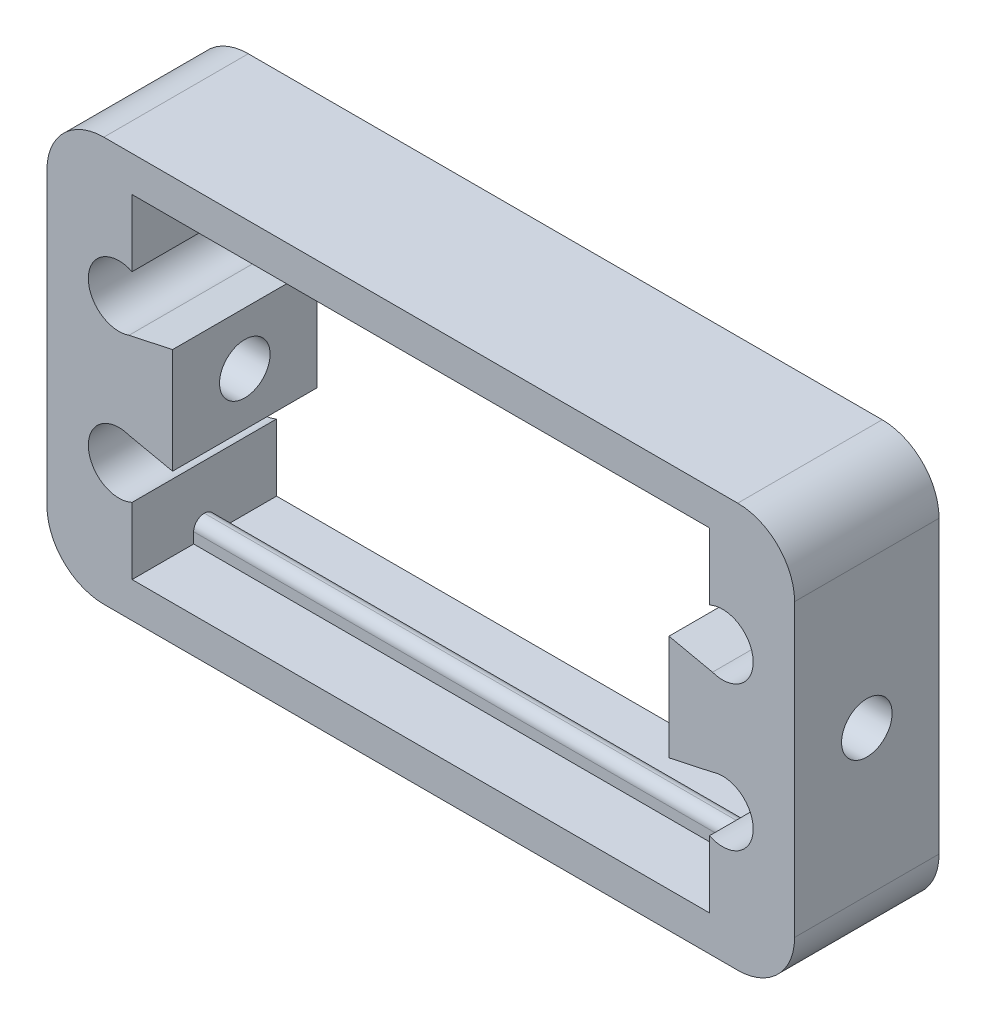
from build123d import *

# Parameters (mm, degrees)
SKETCH1_W                = 26.289
SKETCH1_H                = 14.224
BOSS_EXTRUDE1_DEPTH      = 5.08
BOSS_EXTRUDE2_DEPTH      = 0.375
BOSS_EXTRUDE2_DEPTH_BACK = 0.375
SKETCH2_W                = 20.300617312
SKETCH2_H                = 0.75
FILLET1_R                = 0.375
FILLET2_R                = 2
SKETCH3_R                = 0.889
CUT_EXTRUDE1_DEPTH       = 24.13


with BuildPart() as part:
    # Sketch1 → Boss-Extrude1 (new body)
    with BuildSketch(Plane.XY):
        with Locations((13.1445, 7.112)):
            Rectangle(SKETCH1_W, SKETCH1_H)
        with BuildLine():
            ThreePointArc((2.994191344, 10.624), (1.457238853, 9.709108648), (2.886694423, 8.633977996))
            Line((2.886694423, 8.633977996), (4.417480803, 8.964165012))
            Line((4.417480803, 8.964165012), (4.417480803, 5.259834988))
            Line((4.417480803, 5.259834988), (2.886694423, 5.590022004))
            ThreePointArc((2.886694423, 5.590022004), (1.457238853, 4.514891352), (2.994191344, 3.6))
            Line((2.994191344, 3.6), (2.994191344, 1.25))
            Line((2.994191344, 1.25), (23.294808656, 1.25))
            Line((23.294808656, 1.25), (23.294808656, 3.6))
            ThreePointArc((23.294808656, 3.6), (24.831761147, 4.514891352), (23.402305577, 5.590022004))
            Line((23.402305577, 5.590022004), (21.871519197, 5.259834988))
            Line((21.871519197, 5.259834988), (21.871519197, 8.964165012))
            Line((21.871519197, 8.964165012), (23.402305577, 8.633977996))
            ThreePointArc((23.402305577, 8.633977996), (24.831761147, 9.709108648), (23.294808656, 10.624))
            Line((23.294808656, 10.624), (23.294808656, 12.974))
            Line((23.294808656, 12.974), (2.994191344, 12.974))
            Line((2.994191344, 12.974), (2.994191344, 10.624))
        make_face(mode=Mode.SUBTRACT)
    extrude(amount=BOSS_EXTRUDE1_DEPTH)

    # Sketch2 → Boss-Extrude2 (add, two sides: drawn at the far end of the back side and taken through both)
    with BuildSketch(Plane.XY.offset(2.54).offset(-BOSS_EXTRUDE2_DEPTH_BACK)):
        with Locations((13.1445, 1.625)):
            Rectangle(SKETCH2_W, SKETCH2_H)
        with Locations((13.1445, 12.599)):
            Rectangle(SKETCH2_W, SKETCH2_H)
    extrude(amount=BOSS_EXTRUDE2_DEPTH + BOSS_EXTRUDE2_DEPTH_BACK)

    # Fillet1
    fillet1_edges = [part.edges().sort_by_distance(p)[0] for p in [
        (13.1445, 12.224, 2.165),
        (13.1445, 12.224, 2.915),
        (13.1445, 2, 2.165),
        (13.1445, 2, 2.915),
    ]]
    fillet(fillet1_edges, radius=FILLET1_R - 0.0001)  # a hair under: the kernel refuses the full size

    # Fillet2
    fillet2_edges = [part.edges().sort_by_distance(p)[0] for p in [
        (0, 0, 2.54),
        (0, 14.224, 2.54),
        (26.289, 14.224, 2.54),
        (26.289, 0, 2.54),
    ]]
    fillet(fillet2_edges, radius=FILLET2_R)

    # Sketch3 → Cut-Extrude1 (cut)
    with BuildSketch(Plane(origin=(26.289, 0, 0), x_dir=(0, 0, -1), z_dir=(1, 0, 0))):
        with Locations((-2.54, 7.112)):
            Circle(SKETCH3_R)
    extrude(amount=-CUT_EXTRUDE1_DEPTH, mode=Mode.SUBTRACT)


solid = part.part
